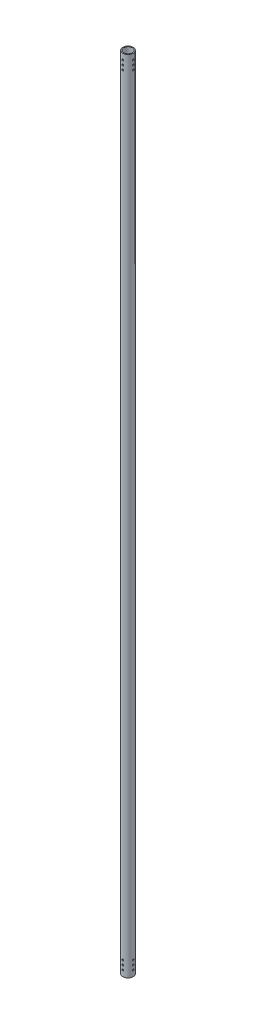
from build123d import *

# Parameters (mm, degrees)
EXTRUDE_1_OUTLINE_R                = 18
EXTRUDE_1_OUTLINE_R_2              = 15
EXTRUDE_1_DEPTH                    = 2781
SKETCH_2_R                         = 3
CUT_EXTRUDE_1_DEPTH                = 2782.116502414
PATTERN_LINEAR_1_COUNT             = 3
PATTERN_LINEAR_1_PITCH             = 15
PATTERN_CIRCULAR_1_COUNT           = 2
PATTERN_CIRCULAR_1_ANGLE           = 90
PATTERN_CIRCULAR_1_COPY_1_SKETCH_R = 3
PATTERN_CIRCULAR_1_COPY_1_DEPTH    = 2782.116502414
PATTERN_CIRCULAR_1_COPY_2_SKETCH_R = 3
PATTERN_CIRCULAR_1_COPY_2_DEPTH    = 2782.116502414


# Read off the part's stored shape, not the designer's step: Вытянуть-Тонкостенный1
with BuildPart() as part:
    # Вытянуть-Тонкостенный1 outline → Вытянуть-Тонкостенный1 (new body)
    with BuildSketch(Plane(origin=(0, 0, 0), x_dir=(1, 0, 0), z_dir=(0, 1, 0))):
        Circle(EXTRUDE_1_OUTLINE_R)
        Circle(EXTRUDE_1_OUTLINE_R_2, mode=Mode.SUBTRACT)
    extrude(amount=EXTRUDE_1_DEPTH)

    # Эскиз2 → Вырез-Вытянуть1 (cut, symmetric)
    with BuildSketch(Plane.XY):
        with Locations((0, 2731)):
            Circle(SKETCH_2_R)
        with Locations((0, 44)):
            Circle(SKETCH_2_R)
    cut_extrude_1 = extrude(amount=CUT_EXTRUDE_1_DEPTH, both=True, mode=Mode.SUBTRACT)

    # Линейный массив1: Вырез-Вытянуть1 ×3
    with Locations(*[(0, i * PATTERN_LINEAR_1_PITCH, 0) for i in range(1, PATTERN_LINEAR_1_COUNT)]):
        add(cut_extrude_1, mode=Mode.SUBTRACT)

    # Круговой массив1: Вырез-Вытянуть1 ×2 about axis
    pattern_circular_1_axis = Axis((0, 2781, 0), (0, -1, 0))
    for i in range(1, PATTERN_CIRCULAR_1_COUNT):
        add(cut_extrude_1.rotate(pattern_circular_1_axis, i * PATTERN_CIRCULAR_1_ANGLE / (PATTERN_CIRCULAR_1_COUNT - 1)), mode=Mode.SUBTRACT)

    # Круговой массив1 copy 1 sketch → Круговой массив1 copy 1 (cut, symmetric)
    with BuildSketch(Plane(origin=(0, 15, 0), x_dir=(0, 0, 1), z_dir=(-1, 0, 0))):
        with Locations((0, 2731)):
            Circle(PATTERN_CIRCULAR_1_COPY_1_SKETCH_R)
        with Locations((0, 44)):
            Circle(PATTERN_CIRCULAR_1_COPY_1_SKETCH_R)
    extrude(amount=PATTERN_CIRCULAR_1_COPY_1_DEPTH, both=True, mode=Mode.SUBTRACT)

    # Круговой массив1 copy 2 sketch → Круговой массив1 copy 2 (cut, symmetric)
    with BuildSketch(Plane(origin=(0, 30, 0), x_dir=(0, 0, 1), z_dir=(-1, 0, 0))):
        with Locations((0, 2731)):
            Circle(PATTERN_CIRCULAR_1_COPY_2_SKETCH_R)
        with Locations((0, 44)):
            Circle(PATTERN_CIRCULAR_1_COPY_2_SKETCH_R)
    extrude(amount=PATTERN_CIRCULAR_1_COPY_2_DEPTH, both=True, mode=Mode.SUBTRACT)

    # Surface Cut 1
    split(bisect_by=Plane(origin=(0, 24, 0), x_dir=(1, 0, 0), z_dir=(0, 1, 0)), keep=Keep.TOP)


solid = part.part
